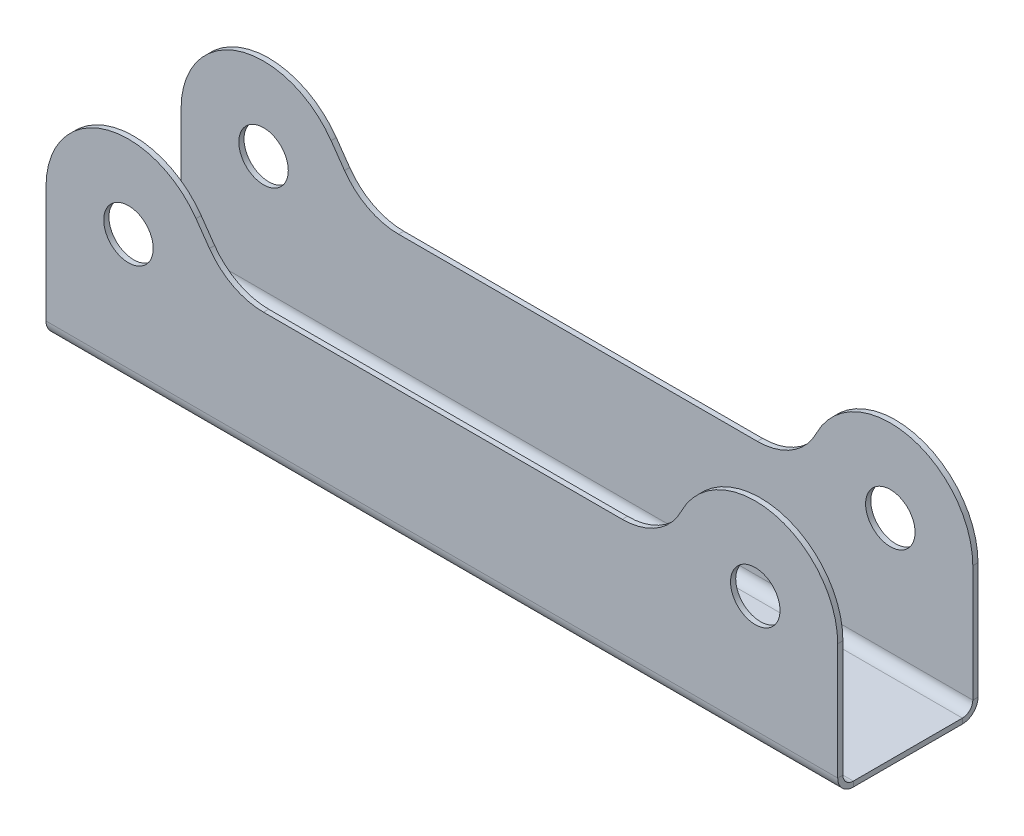
from build123d import *

# Parameters (mm, degrees)
BASE_EXTRUDE_DEPTH         = 13.5
FILLET1_R                  = 12.7
SHELL1_T                   = -1
SKETCH2_R                  = 4.7625
CUT_EXTRUDE1_DEPTH         = 142.468143499
FLATTEN_BENDS1_START       = -24.4
FLATTEN_BENDS1_OUTLINE_W   = 152.4
FLATTEN_BENDS1_OUTLINE_H   = 1
FLATTEN_BENDS1_DEPTH       = 41.4
FLATTEN_BENDS1_START_2     = -25.4
FLATTEN_BENDS1_2_OUTLINE_R = 4.7625
FLATTEN_BENDS1_2_DEPTH     = 1
PROCESS_BENDS1_START       = -54
PROCESS_BENDS1_OUTLINE_W   = 152.4
PROCESS_BENDS1_OUTLINE_H   = 1
PROCESS_BENDS1_DEPTH       = 40.80822
PROCESS_BENDS1_START_2     = 13.19178
PROCESS_BENDS1_2_OUTLINE_W = 152.4
PROCESS_BENDS1_2_OUTLINE_H = 1
PROCESS_BENDS1_2_DEPTH     = 40.80822
PROCESS_BENDS1_START_3     = -13.5
PROCESS_BENDS1_3_OUTLINE_R = 4.7625
PROCESS_BENDS1_3_DEPTH     = 3
PROCESS_BENDS1_START_4     = 10.5
PROCESS_BENDS1_4_OUTLINE_R = 4.7625
PROCESS_BENDS1_4_DEPTH     = 3
PROCESS_BENDS1_START_5     = -15.875
PROCESS_BENDS1_5_DEPTH     = 152.4


with BuildPart() as part:
    # Sketch1 → Base-Extrude (new, symmetric)
    with BuildSketch(Plane.XY):
        with BuildLine():
            Line((-15.875, 0), (-15.875, -25.4))
            Line((-15.875, -25.4), (136.525, -25.4))
            Line((136.525, -25.4), (136.525, 0))
            ThreePointArc((136.525, 0), (123.40666482, 15.633823079), (105.732379645, 5.429569775))
            Line((105.732379645, 5.429569775), (103.756177862, 0))
            Line((103.756177862, 0), (19.379796597, 0))
            Line((19.379796597, 0), (13.004038703, 9.105525927))
            ThreePointArc((13.004038703, 9.105525927), (-4.773704567, 15.140256593), (-15.875, 0))
        make_face()
    extrude(amount=BASE_EXTRUDE_DEPTH, both=True)

    # Fillet1
    # the kernel refuses this fillet: 12.7 mm, written as the material it adds along each edge
    with BuildSketch(Plane(origin=(103.756177862, 0, -13.5), x_dir=(-1, 0, 0), z_dir=(0, 0, 1))) as fillet1_piece_1:
        with BuildLine():
            CenterArc((8.703846213, -12.7), FILLET1_R, 90, 63.612200039)
            Line((-2.672895276, -7.055555556), (-3.810569425, -6.491111111))
            ThreePointArc((-3.810569425, -6.491111111), (-3.169611411, -4.995204193), (-1.193409628, 0.434365582))
            Line((-1.193409628, 0.434365582), (0, 1.27))
            Line((0, 1.27), (8.703846213, 1.27))
            Line((8.703846213, 1.27), (8.703846213, 0))
        make_face()
    extrude(amount=27)
    with BuildSketch(Plane(origin=(19.379796597, 0, 13.5), x_dir=(-0.5735764363510504, 0.8191520442889888, 0), z_dir=(0, 0, -1))) as fillet1_piece_2:
        with BuildLine():
            CenterArc((FILLET1_R * 0.520567050552, FILLET1_R), FILLET1_R, 215, 55)
            Line((-FILLET1_R * 0.298584993737, FILLET1_R * 0.426423563649), (0, 0))
            Line((0, 0), (FILLET1_R * 0.520567050552, 0))
        make_face()
    extrude(amount=27)

    # Shell1
    shell1_openings = [part.faces().sort_by_distance(p)[0] for p in [
        (-15.875, -12.7, 0),
        (136.525, -12.7, 0),
        (124.273424559, 15.45595094, 0),
        (60.521664894, 0, 0),
        (14.29590294, 7.260552593, 0),
        (-4.773704567, 15.140256593, 0),
        (20.126790751, 1.434962419, 0),
        (101.745819363, 1.907075363, 0),
    ]]
    offset(amount=SHELL1_T, openings=shell1_openings, kind=Kind.INTERSECTION)

    # Sketch2 → Cut-Extrude1 (cut, through all)
    with BuildSketch(Plane.XY.offset(13.5)):
        with Locations((120.65, 0)):
            Circle(SKETCH2_R)
        Circle(SKETCH2_R)
    extrude(amount=-CUT_EXTRUDE1_DEPTH, mode=Mode.SUBTRACT)

    # Flatten-Bends1: read off the stored shape, not the designer's step
    # Flatten-Bends1 outline → Flatten-Bends1 (cut)
    with BuildSketch(Plane(origin=(0, 0, 0), x_dir=(1, 0, 0), z_dir=(0, 1, 0)).offset(FLATTEN_BENDS1_START)):
        with Locations((60.325, 13)):
            Rectangle(FLATTEN_BENDS1_OUTLINE_W, FLATTEN_BENDS1_OUTLINE_H)
        with Locations((60.325, -13)):
            Rectangle(FLATTEN_BENDS1_OUTLINE_W, FLATTEN_BENDS1_OUTLINE_H)
    extrude(amount=FLATTEN_BENDS1_DEPTH, mode=Mode.SUBTRACT)

    # Flatten-Bends1 2 outline → Flatten-Bends1 2 (add)
    # profile 1 of 2: a face of its own
    with BuildSketch(Plane(origin=(0, 0, 0), x_dir=(1, 0, 0), z_dir=(0, 1, 0)).offset(FLATTEN_BENDS1_START_2)):
        with BuildLine():
            ThreePointArc((106.429073138, -43.882546373), (124.273424559, -52.282941757), (136.525, -36.826990817))
            Line((136.525, -36.826990817), (136.525, -13.5))
            Line((136.525, -13.5), (-15.875, -13.5))
            Line((-15.875, -13.5), (-15.875, -36.826990817))
            ThreePointArc((-15.875, -36.826990817), (-4.773704567, -51.96724741), (13.004038703, -45.932516744))
            Line((13.004038703, -45.932516744), (15.587767176, -42.242570075))
            ThreePointArc((15.587767176, -42.242570075), (20.126790751, -38.261953236), (25.990998139, -36.826990817))
            Line((25.990998139, -36.826990817), (95.052331649, -36.826990817))
            ThreePointArc((95.052331649, -36.826990817), (101.745819363, -38.73406618), (106.429073138, -43.882546373))
        make_face()
        with Locations((0, -36.826990817)):
            Circle(FLATTEN_BENDS1_2_OUTLINE_R, mode=Mode.SUBTRACT)
        with Locations((120.65, -36.826990817)):
            Circle(FLATTEN_BENDS1_2_OUTLINE_R, mode=Mode.SUBTRACT)
    # profile 2 of 2: a face of its own
    with BuildSketch(Plane(origin=(0, 0, 0), x_dir=(1, 0, 0), z_dir=(0, 1, 0)).offset(FLATTEN_BENDS1_START_2)):
        with BuildLine():
            Line((-15.875, 36.826990817), (-15.875, 13.5))
            Line((-15.875, 13.5), (136.525, 13.5))
            Line((136.525, 13.5), (136.525, 36.826990817))
            ThreePointArc((136.525, 36.826990817), (124.273424559, 52.282941757), (106.429073138, 43.882546373))
            ThreePointArc((106.429073138, 43.882546373), (101.745819363, 38.73406618), (95.052331649, 36.826990817))
            Line((95.052331649, 36.826990817), (25.990998139, 36.826990817))
            ThreePointArc((25.990998139, 36.826990817), (20.126790751, 38.261953236), (15.587767176, 42.242570075))
            Line((15.587767176, 42.242570075), (13.004038703, 45.932516744))
            ThreePointArc((13.004038703, 45.932516744), (-4.773704567, 51.96724741), (-15.875, 36.826990817))
        make_face()
        with Locations((0, 36.826990817)):
            Circle(FLATTEN_BENDS1_2_OUTLINE_R, mode=Mode.SUBTRACT)
        with Locations((120.65, 36.826990817)):
            Circle(FLATTEN_BENDS1_2_OUTLINE_R, mode=Mode.SUBTRACT)
    extrude(amount=FLATTEN_BENDS1_2_DEPTH)

    # Process-Bends1: read off the stored shape, not the designer's step
    # Process-Bends1 outline → Process-Bends1 (cut)
    with BuildSketch(Plane.XY.offset(PROCESS_BENDS1_START)):
        with Locations((60.325, -24.9)):
            Rectangle(PROCESS_BENDS1_OUTLINE_W, PROCESS_BENDS1_OUTLINE_H)
    extrude(amount=PROCESS_BENDS1_DEPTH, mode=Mode.SUBTRACT)

    # Process-Bends1 2 outline → Process-Bends1 2 (cut)
    with BuildSketch(Plane.XY.offset(PROCESS_BENDS1_START_2)):
        with Locations((60.325, -24.9)):
            Rectangle(PROCESS_BENDS1_2_OUTLINE_W, PROCESS_BENDS1_2_OUTLINE_H)
    extrude(amount=PROCESS_BENDS1_2_DEPTH, mode=Mode.SUBTRACT)

    # Process-Bends1 3 outline → Process-Bends1 3 (add)
    with BuildSketch(Plane.XY.offset(PROCESS_BENDS1_START_3)):
        with BuildLine():
            Line((136.525, -24.4), (136.525, 0))
            ThreePointArc((136.525, 0), (124.273424559, 15.45595094), (106.429073138, 7.055555556))
            ThreePointArc((106.429073138, 7.055555556), (101.745819363, 1.907075363), (95.052331649, 0))
            Line((95.052331649, 0), (25.990998139, 0))
            ThreePointArc((25.990998139, 0), (20.126790751, 1.434962419), (15.587767176, 5.415579258))
            Line((15.587767176, 5.415579258), (13.004038703, 9.105525927))
            ThreePointArc((13.004038703, 9.105525927), (-4.773704567, 15.140256593), (-15.875, 0))
            Line((-15.875, 0), (-15.875, -24.4))
            Line((-15.875, -24.4), (136.525, -24.4))
        make_face()
        Circle(PROCESS_BENDS1_3_OUTLINE_R, mode=Mode.SUBTRACT)
        with Locations((120.65, 0)):
            Circle(PROCESS_BENDS1_3_OUTLINE_R, mode=Mode.SUBTRACT)
    extrude(amount=PROCESS_BENDS1_3_DEPTH)

    # Process-Bends1 4 outline → Process-Bends1 4 (add)
    with BuildSketch(Plane.XY.offset(PROCESS_BENDS1_START_4)):
        with BuildLine():
            Line((136.525, -24.4), (136.525, 0))
            ThreePointArc((136.525, 0), (124.273424559, 15.45595094), (106.429073138, 7.055555556))
            ThreePointArc((106.429073138, 7.055555556), (101.745819363, 1.907075363), (95.052331649, 0))
            Line((95.052331649, 0), (25.990998139, 0))
            ThreePointArc((25.990998139, 0), (20.126790751, 1.434962419), (15.587767176, 5.415579258))
            Line((15.587767176, 5.415579258), (13.004038703, 9.105525927))
            ThreePointArc((13.004038703, 9.105525927), (-4.773704567, 15.140256593), (-15.875, 0))
            Line((-15.875, 0), (-15.875, -24.4))
            Line((-15.875, -24.4), (136.525, -24.4))
        make_face()
        Circle(PROCESS_BENDS1_4_OUTLINE_R, mode=Mode.SUBTRACT)
        with Locations((120.65, 0)):
            Circle(PROCESS_BENDS1_4_OUTLINE_R, mode=Mode.SUBTRACT)
    extrude(amount=PROCESS_BENDS1_4_DEPTH)

    # Process-Bends1 5 outline → Process-Bends1 5 (cut)
    with BuildSketch(Plane.YZ.offset(PROCESS_BENDS1_START_5)):
        with BuildLine():
            ThreePointArc((-24.4, -10.5), (-23.814213562, -11.914213562), (-22.4, -12.5))
            Line((-22.4, -12.5), (17, -12.5))
            Line((17, -12.5), (17, -10.5))
            Line((17, -10.5), (-24.4, -10.5))
        make_face()
        with BuildLine():
            Line((0, -15), (0, -13.5))
            Line((0, -13.5), (-22.4, -13.5))
            ThreePointArc((-22.4, -13.5), (-24.521320344, -12.621320344), (-25.4, -10.5))
            Line((-25.4, -10.5), (-25.4, -13.19178))
            Line((-25.4, -13.19178), (-24.4, -13.19178))
            Line((-24.4, -13.19178), (-24.4, -15))
            Line((-24.4, -15), (0, -15))
        make_face()
        with BuildLine():
            ThreePointArc((-22.4, 12.5), (-23.814213562, 11.914213562), (-24.4, 10.5))
            Line((-24.4, 10.5), (17, 10.5))
            Line((17, 10.5), (17, 12.5))
            Line((17, 12.5), (-22.4, 12.5))
        make_face()
        with BuildLine():
            Line((-22.4, 13.5), (0, 13.499999989))
            Line((0, 13.499999989), (0, 15))
            Line((0, 15), (-24.4, 15))
            Line((-24.4, 15), (-24.4, 13.19178))
            Line((-24.4, 13.19178), (-25.4, 13.19178))
            Line((-25.4, 13.19178), (-25.4, 10.5))
            ThreePointArc((-25.4, 10.5), (-24.521320344, 12.621320344), (-22.4, 13.5))
        make_face()
    extrude(amount=PROCESS_BENDS1_5_DEPTH, mode=Mode.SUBTRACT)


solid = part.part
